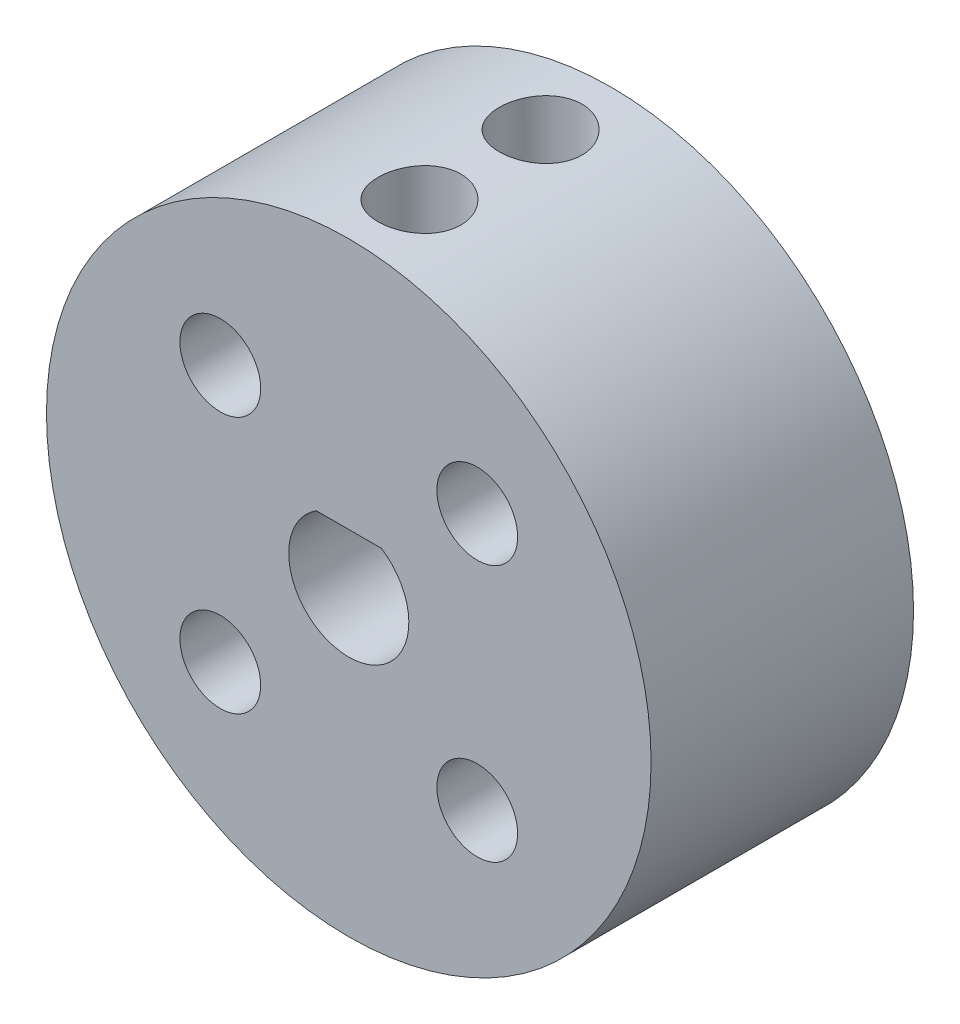
from build123d import *

# Parameters (mm, degrees)
SKETCH1_R           = 14.975
BOSS_EXTRUDE1_DEPTH = 13
SKETCH3_R           = 2.05
CUT_EXTRUDE2_DEPTH  = 16
CUT_EXTRUDE7_DEPTH  = 5
SKETCH12_R          = 2
CUT_EXTRUDE8_DEPTH  = 23.638490621
SKETCH13_R          = 2.975
CUT_EXTRUDE9_DEPTH  = 1


with BuildPart() as part:
    # Sketch1 → Boss-Extrude1 (new body)
    with BuildSketch(Plane.XY):
        Circle(SKETCH1_R)
        with BuildLine():
            Line((1.612645342, 2.5), (-1.612645342, 2.5))
            ThreePointArc((-1.612645342, 2.5), (0, -2.975), (1.612645342, 2.5))
        make_face(mode=Mode.SUBTRACT)
    extrude(amount=BOSS_EXTRUDE1_DEPTH)

    # Sketch3 → Cut-Extrude2 (cut)
    with BuildSketch(Plane(origin=(0, 0, 0), x_dir=(1, 0, 0), z_dir=(0, 1, 0))):
        with Locations((0, -3.5)):
            Circle(SKETCH3_R)
        with Locations((0, -9.5)):
            Circle(SKETCH3_R)
    extrude(amount=CUT_EXTRUDE2_DEPTH, mode=Mode.SUBTRACT)

    # Sketch11 → Cut-Extrude7 (cut)
    with BuildSketch(Plane(origin=(0, 0, 0), x_dir=(-1, 0, 0), z_dir=(0, 0, -1))):
        Polygon((-6.363961031, 2.380244173), (-2.913961031, 4.372102602), (-2.913961031, 8.355819459), (-6.363961031, 10.347677888), (-9.813961031, 8.355819459), (-9.813961031, 4.372102602), align=None)
        Polygon((9.813961031, 8.355819459), (6.363961031, 10.347677888), (2.913961031, 8.355819459), (2.913961031, 4.372102602), (6.363961031, 2.380244173), (9.813961031, 4.372102602), align=None)
        Polygon((9.813961031, -4.372102602), (9.813961031, -8.355819459), (6.363961031, -10.347677888), (2.913961031, -8.355819459), (2.913961031, -4.372102602), (6.363961031, -2.380244173), align=None)
        Polygon((-9.813961031, -4.372102602), (-6.363961031, -2.380244173), (-2.913961031, -4.372102602), (-2.913961031, -8.355819459), (-6.363961031, -10.347677888), (-9.813961031, -8.355819459), align=None)
    extrude(amount=-CUT_EXTRUDE7_DEPTH, mode=Mode.SUBTRACT)

    # Sketch12 → Cut-Extrude8 (cut, through all)
    with BuildSketch(Plane(origin=(0, 0, 5), x_dir=(-1, 0, 0), z_dir=(0, 0, -1))):
        with Locations((-6.363961031, 6.363961031)):
            Circle(SKETCH12_R)
        with Locations((6.363961031, 6.363961031)):
            Circle(SKETCH12_R)
        with Locations((6.363961031, -6.363961031)):
            Circle(SKETCH12_R)
        with Locations((-6.363961031, -6.363961031)):
            Circle(SKETCH12_R)
    extrude(amount=-CUT_EXTRUDE8_DEPTH, mode=Mode.SUBTRACT)

    # Sketch13 → Cut-Extrude9 (cut)
    with BuildSketch(Plane(origin=(0, 0, 0), x_dir=(-1, 0, 0), z_dir=(0, 0, -1))):
        Circle(SKETCH13_R)
    extrude(amount=-CUT_EXTRUDE9_DEPTH, mode=Mode.SUBTRACT)


solid = part.part
